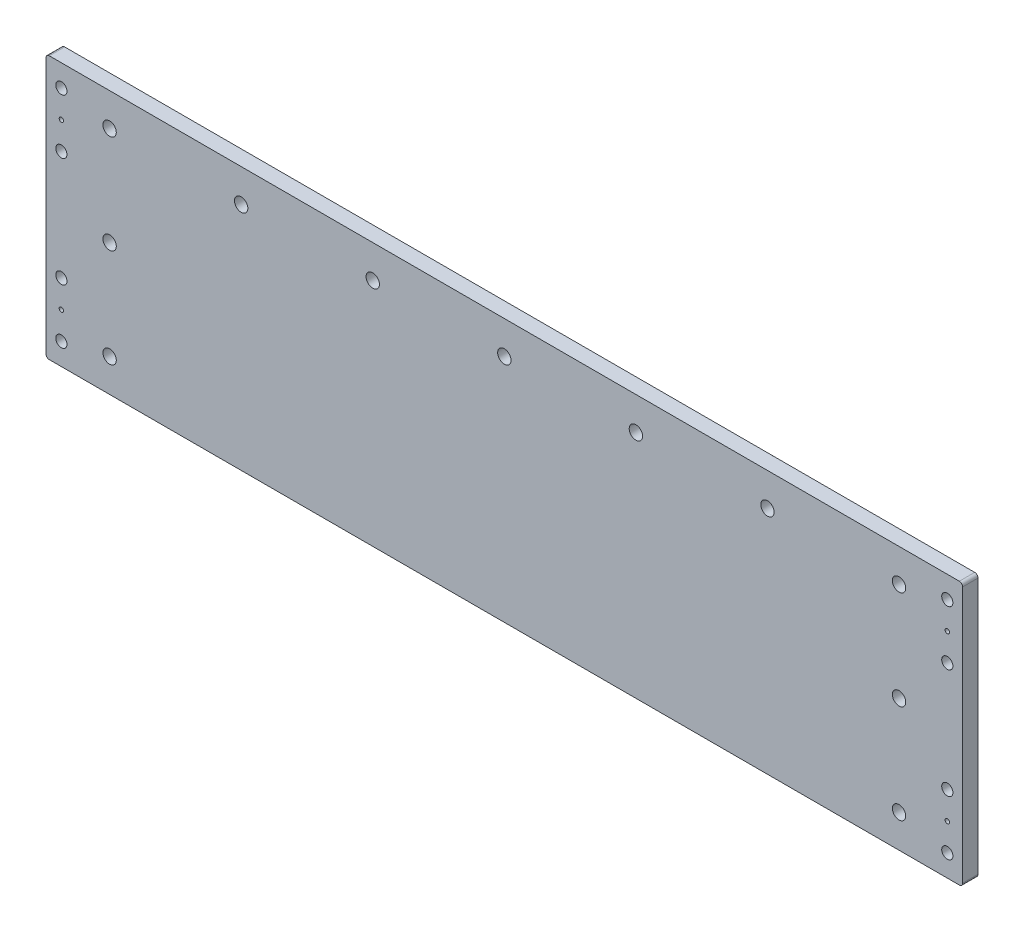
from build123d import *

# Parameters (mm, degrees)
SKETCH1_W                 = 418
SKETCH1_H                 = 120
BOSS_EXTRUDE1_DEPTH       = 3.5
SKETCH3_R                 = 3.05
CUT_EXTRUDE2_DEPTH        = 218.55459085
FILLET1_R                 = 1.5
SKETCH4_R                 = 2.55
SKETCH4_R_2               = 1
CUT_EXTRUDE3_DEPTH        = 218.55459085
MIRROR2_COPY_1_SKETCH_R   = 2.55
MIRROR2_COPY_1_SKETCH_R_2 = 1
MIRROR2_COPY_1_DEPTH      = 218.55459085


with BuildPart() as part:
    # Sketch1 → Boss-Extrude1 (new, symmetric)
    with BuildSketch(Plane.XY):
        Rectangle(SKETCH1_W, SKETCH1_H)
    extrude(amount=BOSS_EXTRUDE1_DEPTH, both=True)

    # Sketch3 → Cut-Extrude2 (cut, through all)
    with BuildSketch(Plane.XY.offset(3.5)):
        with Locations((-180, 45)):
            Circle(SKETCH3_R)
        with Locations((180, 45)):
            Circle(SKETCH3_R)
        with Locations((180, -45)):
            Circle(SKETCH3_R)
        with Locations((-180, -45)):
            Circle(SKETCH3_R)
        with Locations((0, 45)):
            Circle(SKETCH3_R)
        with Locations((-120, 45)):
            Circle(SKETCH3_R)
        with Locations((120, 45)):
            Circle(SKETCH3_R)
        with Locations((-180, 0)):
            Circle(SKETCH3_R)
        with Locations((-60, 45)):
            Circle(SKETCH3_R)
        with Locations((60, 45)):
            Circle(SKETCH3_R)
        with Locations((180, 0)):
            Circle(SKETCH3_R)
    extrude(amount=-CUT_EXTRUDE2_DEPTH, mode=Mode.SUBTRACT)

    # Fillet1
    fillet1_edges = [part.edges().sort_by_distance(p)[0] for p in [
        (-209, -60, 0),
        (209, -60, 0),
        (209, 60, 0),
        (-209, 60, 0),
    ]]
    fillet(fillet1_edges, radius=FILLET1_R)

    # Sketch4 → Cut-Extrude3 (cut, through all)
    with BuildSketch(Plane.XY.offset(3.5)):
        with Locations((-202, 50)):
            Circle(SKETCH4_R)
        with Locations((-202, 37.5)):
            Circle(SKETCH4_R_2)
        with Locations((-202, 25)):
            Circle(SKETCH4_R)
    cut_extrude3 = extrude(amount=-CUT_EXTRUDE3_DEPTH, mode=Mode.SUBTRACT)

    # Mirror1: Cut-Extrude3 across plane
    add(cut_extrude3.mirror(Plane.ZX), mode=Mode.SUBTRACT)

    # Mirror2: Cut-Extrude3 across plane
    add(cut_extrude3.mirror(Plane(origin=(0, 0, 0), x_dir=(0, 0, 1), z_dir=(1, 0, 0))), mode=Mode.SUBTRACT)

    # Mirror2 copy 1 sketch → Mirror2 copy 1 (cut, through all)
    with BuildSketch(Plane(origin=(0, 0, 3.5), x_dir=(-1, 0, 0), z_dir=(0, 0, 1))):
        with Locations((-202, 50)):
            Circle(MIRROR2_COPY_1_SKETCH_R)
        with Locations((-202, 37.5)):
            Circle(MIRROR2_COPY_1_SKETCH_R_2)
        with Locations((-202, 25)):
            Circle(MIRROR2_COPY_1_SKETCH_R)
    extrude(amount=-MIRROR2_COPY_1_DEPTH, mode=Mode.SUBTRACT)


solid = part.part
